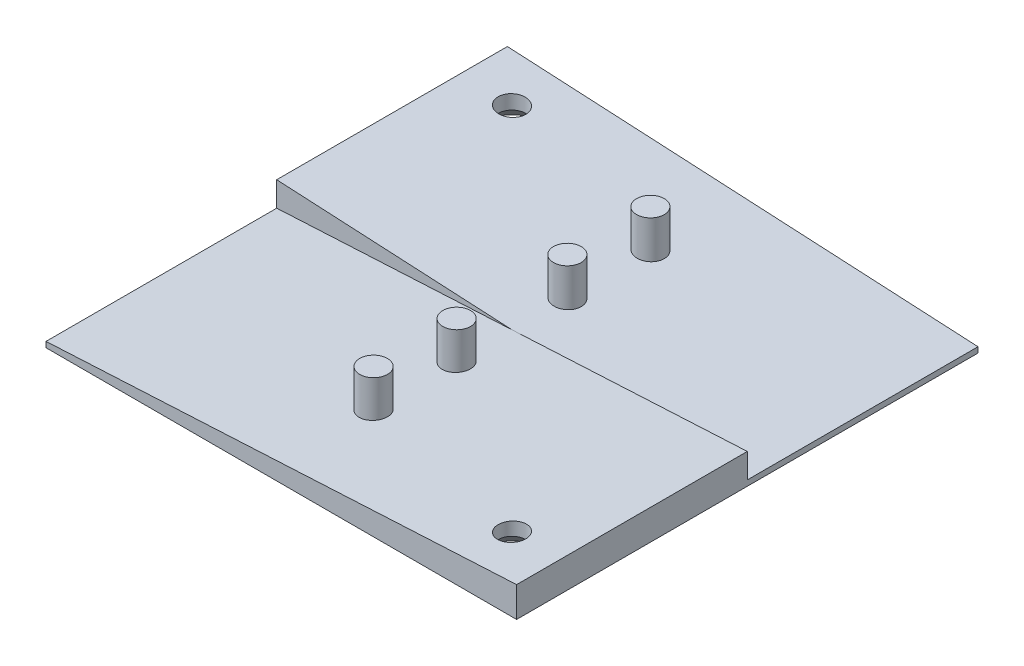
from build123d import *

# Parameters (mm, degrees)
ESBO_O2_W                = 51
ESBO_O2_H                = 50
RESSALTO_EXTRUS_O2_DEPTH = 6
CORTE_EXTRUS_O1_DEPTH    = 25
CORTE_EXTRUS_O3_DEPTH    = 25
ESBO_O5_R                = 1.5
RESSALTO_EXTRUS_O3_DEPTH = 6
ESBO_O8_R                = 1.5
CORTE_EXTRUS_O6_DEPTH    = 37.211186117
CHANFRO1_SIZE            = 1.5


with BuildPart() as part:
    # Esboço2 → Ressalto-extrusão2 (new body)
    with BuildSketch(Plane(origin=(0, 0, 0), x_dir=(1, 0, 0), z_dir=(0, 1, 0))):
        Rectangle(ESBO_O2_W, ESBO_O2_H)
    extrude(amount=RESSALTO_EXTRUS_O2_DEPTH)

    # Esboço3 → Corte-extrusão1 (cut)
    with BuildSketch(Plane.XY.offset(25)):
        Polygon((-25.5, 0.6), (25.5, 3.272796743), (25.5, 6), (-25.5, 6), align=None)
    extrude(amount=-CORTE_EXTRUS_O1_DEPTH, mode=Mode.SUBTRACT)

    # Esboço4 → Corte-extrusão3 (cut)
    with BuildSketch(Plane(origin=(0, 0, -25), x_dir=(-1, 0, 0), z_dir=(0, 0, -1))):
        Polygon((-25.5, 0.6), (25.5, 3.272796743), (25.5, 6), (-25.5, 6), align=None)
    extrude(amount=-CORTE_EXTRUS_O3_DEPTH, mode=Mode.SUBTRACT)

    # Esboço5 → Ressalto-extrusão3 (add)
    with BuildSketch(Plane.XZ):
        with Locations((0, 6)):
            Circle(ESBO_O5_R)
        with Locations((0, 15)):
            Circle(ESBO_O5_R)
        with Locations((0, -15)):
            Circle(ESBO_O5_R)
        with Locations((0, -6)):
            Circle(ESBO_O5_R)
    extrude(amount=-RESSALTO_EXTRUS_O3_DEPTH)

    # Esboço8 → Corte-extrusão6 (cut, through all)
    with BuildSketch(Plane.XZ):
        with Locations((20, 20)):
            Circle(ESBO_O8_R)
        with Locations((-20, -20)):
            Circle(ESBO_O8_R)
    extrude(amount=-CORTE_EXTRUS_O6_DEPTH, mode=Mode.SUBTRACT)

    # Chanfro1
    chanfro1_edges = [part.edges().sort_by_distance(p)[0] for p in [
        (-21.5, 0, -20),
        (18.5, 0, 20),
    ]]
    chamfer(chanfro1_edges, length=CHANFRO1_SIZE)


solid = part.part
